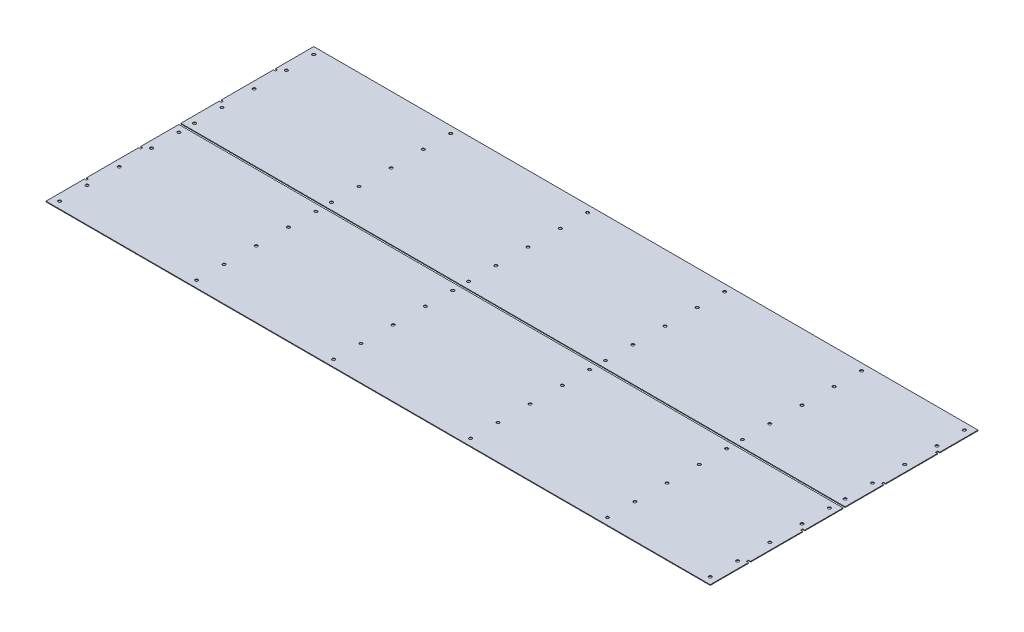
from build123d import *

# Parameters (mm, degrees)
SKETCH1_R           = 2.15
BOSS_EXTRUDE1_DEPTH = 1
LPATTERN2_COUNT     = 2
LPATTERN2_PITCH     = 197


with BuildPart() as part:
    # Sketch1 → Boss-Extrude1 (new body)
    with BuildSketch(Plane(origin=(0, 0, 0), x_dir=(1, 0, 0), z_dir=(0, 1, 0))):
        Polygon((-10, -41), (-10, -97), (960, -97), (960, -41), (957, -41), (957, -38), (960, -38), (960, 38), (957, 38), (957, 41), (960, 41), (960, 97), (-10, 97), (-10, 41), (-7, 41), (-7, 38), (-10, 38), (-10, -38), (-7, -38), (-7, -41), align=None)
        with Locations((0, -47)):
            Circle(SKETCH1_R, mode=Mode.SUBTRACT)
        with Locations((0, 47)):
            Circle(SKETCH1_R, mode=Mode.SUBTRACT)
        with Locations((0, -87)):
            Circle(SKETCH1_R, mode=Mode.SUBTRACT)
        with Locations((0, 87)):
            Circle(SKETCH1_R, mode=Mode.SUBTRACT)
        with Locations((200, -87)):
            Circle(SKETCH1_R, mode=Mode.SUBTRACT)
        with Locations((200, -47)):
            Circle(SKETCH1_R, mode=Mode.SUBTRACT)
        with Locations((200, 47)):
            Circle(SKETCH1_R, mode=Mode.SUBTRACT)
        with Locations((200, 87)):
            Circle(SKETCH1_R, mode=Mode.SUBTRACT)
        with Locations((400, -87)):
            Circle(SKETCH1_R, mode=Mode.SUBTRACT)
        with Locations((400, -47)):
            Circle(SKETCH1_R, mode=Mode.SUBTRACT)
        with Locations((400, 47)):
            Circle(SKETCH1_R, mode=Mode.SUBTRACT)
        with Locations((400, 87)):
            Circle(SKETCH1_R, mode=Mode.SUBTRACT)
        with Locations((600, -87)):
            Circle(SKETCH1_R, mode=Mode.SUBTRACT)
        with Locations((600, -47)):
            Circle(SKETCH1_R, mode=Mode.SUBTRACT)
        with Locations((600, 47)):
            Circle(SKETCH1_R, mode=Mode.SUBTRACT)
        with Locations((600, 87)):
            Circle(SKETCH1_R, mode=Mode.SUBTRACT)
        with Locations((800, -87)):
            Circle(SKETCH1_R, mode=Mode.SUBTRACT)
        with Locations((800, -47)):
            Circle(SKETCH1_R, mode=Mode.SUBTRACT)
        with Locations((800, 47)):
            Circle(SKETCH1_R, mode=Mode.SUBTRACT)
        with Locations((800, 87)):
            Circle(SKETCH1_R, mode=Mode.SUBTRACT)
        Circle(SKETCH1_R, mode=Mode.SUBTRACT)
        with Locations((950, 0)):
            Circle(SKETCH1_R, mode=Mode.SUBTRACT)
        with Locations((200, 0)):
            Circle(SKETCH1_R, mode=Mode.SUBTRACT)
        with Locations((400, 0)):
            Circle(SKETCH1_R, mode=Mode.SUBTRACT)
        with Locations((600, 0)):
            Circle(SKETCH1_R, mode=Mode.SUBTRACT)
        with Locations((800, 0)):
            Circle(SKETCH1_R, mode=Mode.SUBTRACT)
        with Locations((950, 87)):
            Circle(SKETCH1_R, mode=Mode.SUBTRACT)
        with Locations((950, 47)):
            Circle(SKETCH1_R, mode=Mode.SUBTRACT)
        with Locations((950, -47)):
            Circle(SKETCH1_R, mode=Mode.SUBTRACT)
        with Locations((950, -87)):
            Circle(SKETCH1_R, mode=Mode.SUBTRACT)
    extrude(amount=BOSS_EXTRUDE1_DEPTH)


with BuildPart() as lpattern2_1:
    # LPattern2: pattern copy
    add(part.part.moved(Location(Vector(0, 0, -1) * (1 * LPATTERN2_PITCH))))


solid = Compound([part.part, lpattern2_1.part])
